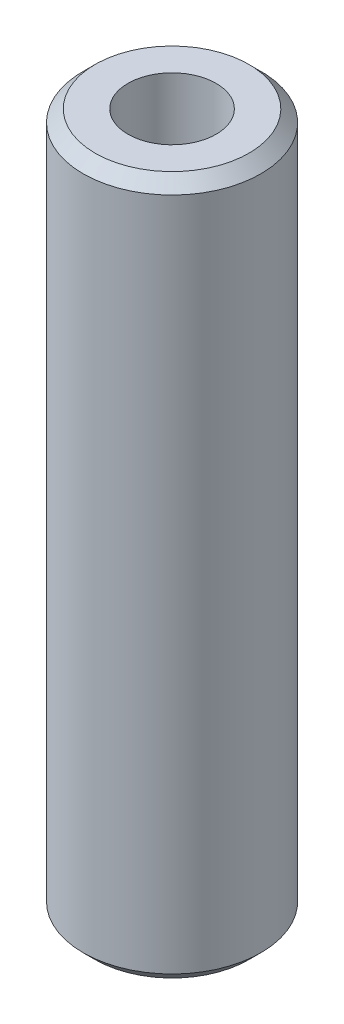
from build123d import *

# Parameters (mm, degrees)
SKETCH1_R           = 10
BOSS_EXTRUDE1_DEPTH = 78.623744074
SKETCH2_R           = 4.965234288
CUT_EXTRUDE1_DEPTH  = 80.885500138
CHAMFER1_SIZE       = 1.33907146


with BuildPart() as part:
    # Sketch1 → Boss-Extrude1 (new body)
    with BuildSketch(Plane(origin=(0, 0, 0), x_dir=(1, 0, 0), z_dir=(0, 1, 0))):
        Circle(SKETCH1_R)
    extrude(amount=BOSS_EXTRUDE1_DEPTH)

    # Sketch2 → Cut-Extrude1 (cut, through all)
    with BuildSketch(Plane(origin=(0, 0, 0), x_dir=(1, 0, 0), z_dir=(0, 1, 0))):
        Circle(SKETCH2_R)
    extrude(amount=CUT_EXTRUDE1_DEPTH, mode=Mode.SUBTRACT)

    # Chamfer1
    chamfer1_edges = [part.edges().sort_by_distance(p)[0] for p in [
        (-10, 78.623744074, 0),
        (-10, 0, 0),
    ]]
    chamfer(chamfer1_edges, length=CHAMFER1_SIZE)


solid = part.part
